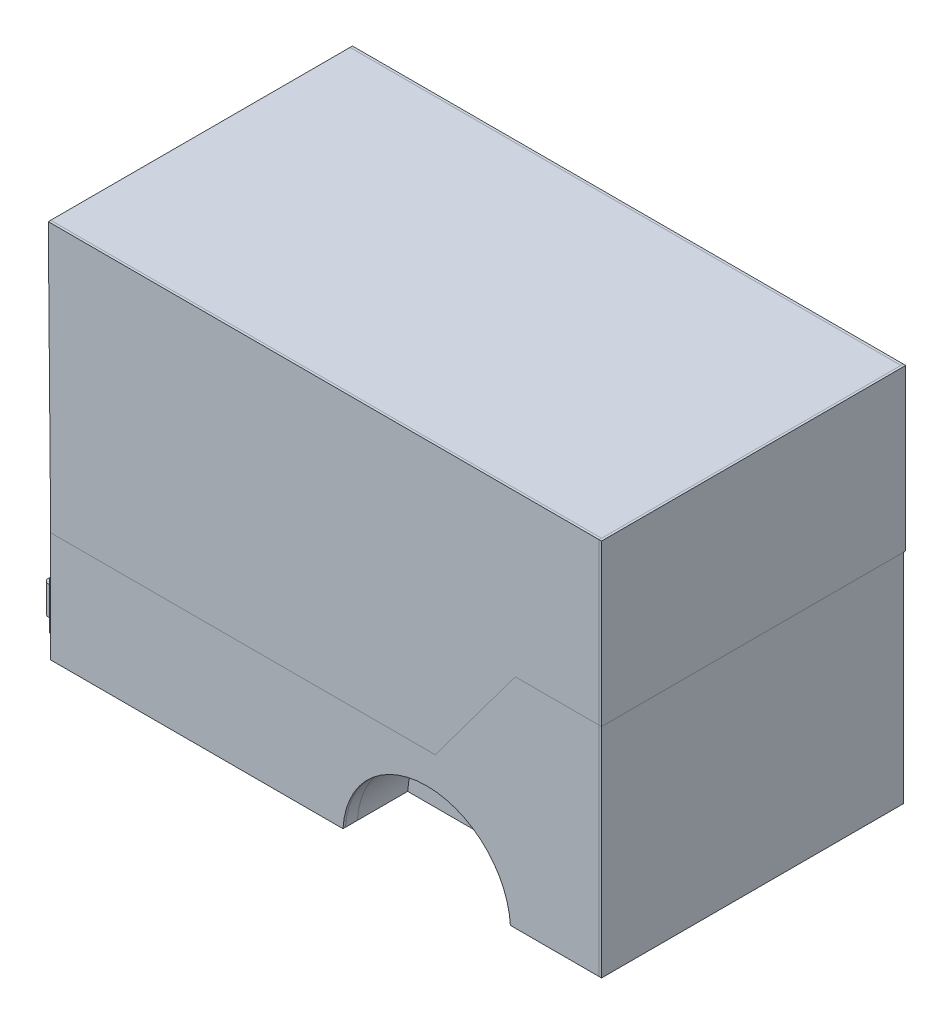
from build123d import *

# Parameters (mm, degrees)
SKETCH_1_W                = 229
SKETCH_1_H                = 125
EXTRUDE_1_DEPTH           = 88
SKETCH_4_W                = 125
SKETCH_4_H                = 88
SKETCH_4_W_2              = 123
SKETCH_4_H_2              = 86
CUT_EXTRUDE_3_DEPTH       = 1
SKETCH_5_W                = 125
SKETCH_5_H                = 88
EXTRUDE_2_DEPTH           = 1
SKETCH_11_W               = 5
SKETCH_11_H               = 20
EXTRUDE_3_DEPTH           = 2
SKETCH_12_R               = 2
EXTRUDE_4_DEPTH           = 12
SKETCH_13_R               = 35
CUT_EXTRUDE_7_DEPTH       = 26
CUT_EXTRUDE_START         = -26
SKETCH_14_R               = 35
CUT_EXTRUDE_8_DEPTH       = 26
SKETCH_16_W               = 229
SKETCH_16_H               = 125
EXTRUDE_6_DEPTH           = 70
SHELL_START               = -980.231317195
SHELL_1_OUTLINE_W         = 148
SHELL_1_OUTLINE_H         = 115
SHELL_1_DEPTH             = 113.617262665
SHELL_START_2             = -787.84857986
SHELL_1_2_OUTLINE_W       = 148
SHELL_1_2_OUTLINE_H       = 115
SHELL_1_2_DEPTH           = 31.617262665
SHELL_1_3_OUTLINE_W       = 3
SHELL_1_3_OUTLINE_H       = 63
SHELL_1_3_DEPTH           = 224
SHELL_START_3             = -981.231317195
SHELL_1_4_DEPTH           = 1
SHELL_START_4             = 7.020467364
SHELL_1_5_DEPTH           = 115
SHELL_START_5             = 33.020467364
SHELL_1_6_DEPTH           = 63
CUT_EXTRUDE_START_2       = -70
CUT_EXTRUDE_9_DEPTH       = 70
SKETCH_20_W               = 125
SKETCH_20_H               = 158
SKETCH_20_W_2             = 115
SKETCH_20_H_2             = 148
EXTRUDE_7_DEPTH           = 1
CUT_EXTRUDE_START_3       = -5
CUT_EXTRUDE_14_DEPTH      = 5
EXTRUDE_8_DEPTH           = 5
SKETCH_26_W               = 230
SKETCH_26_H               = 125
CUT_EXTRUDE_15_DEPTH      = 5
SKETCH_27_W               = 230
SKETCH_27_H               = 125
EXTRUDE_9_DEPTH           = 5
SKETCH_28_W               = 5
SKETCH_28_H               = 115
EXTRUDE_10_DEPTH          = 148
EXTRUDE_11_DEPTH          = 1
EXTRUDE_12_DEPTH          = 1
SKETCH_32_W               = 127
SKETCH_32_H               = 67.090624259
EXTRUDE_13_DEPTH          = 1
SKETCH_33_W               = 126
SKETCH_33_H               = 90.909375741
EXTRUDE_14_DEPTH          = 1
CUT_EXTRUDE_16_DEPTH      = 40
CUT_EXTRUDE_16_DEPTH_BACK = 10
SKETCH_34_W               = 225
SKETCH_34_H               = 5
SKETCH_35_W               = 220
SKETCH_35_H               = 153
EXTRUDE_16_DEPTH          = 5
SKETCH_36_W               = 5
SKETCH_36_H               = 153
EXTRUDE_17_DEPTH          = 5
CUT_EXTRUDE_17_DEPTH      = 5
SKETCH_39_W               = 115
SKETCH_39_H               = 5
CUT_EXTRUDE_18_DEPTH      = 5
SKETCH_40_W               = 5
SKETCH_40_H               = 120
EXTRUDE_19_DEPTH          = 153
SKETCH_45_W               = 78.76547467
SKETCH_45_H               = 26
EXTRUDE_21_DEPTH          = 33
CUT_EXTRUDE_20_DEPTH      = 21
SKETCH_48_R               = 34.912032086
CUT_EXTRUDE_21_DEPTH      = 21


with BuildPart() as part:
    # 스케치1 → 보스-돌출1 (new body)
    with BuildSketch(Plane(origin=(0, 0, 0), x_dir=(1, 0, 0), z_dir=(0, 1, 0))):
        with Locations((-871.731317195, -64.520467364)):
            Rectangle(SKETCH_1_W, SKETCH_1_H)
    extrude(amount=EXTRUDE_1_DEPTH)

    # 스케치4 → 컷-돌출3 (cut)
    # profile 1 of 2: a face of its own
    with BuildSketch(Plane.ZY.offset(986.231317195)):
        with Locations((64.520467364, 44)):
            Rectangle(SKETCH_4_W, SKETCH_4_H)
        with Locations((64.520467364, 44)):
            Rectangle(SKETCH_4_W_2, SKETCH_4_H_2, mode=Mode.SUBTRACT)
    # profile 2 of 2: a face of its own
    with BuildSketch(Plane.ZY.offset(986.231317195)):
        with BuildLine():
            Line((6.020467364, 84), (6.020467364, 67.306026885))
            ThreePointArc((6.020467364, 67.306026885), (6.552613646, 56.95178287), (8.143444971, 46.70664722))
            Line((8.143444971, 46.70664722), (8.939528918, 42.885444272))
            ThreePointArc((8.939528918, 42.885444272), (10.498858633, 32.843182595), (11.020467364, 22.693973115))
            Line((11.020467364, 22.693973115), (11.020467364, 2))
            Line((11.020467364, 2), (118.020467364, 2))
            Line((118.020467364, 2), (118.020467364, 22.693973115))
            ThreePointArc((118.020467364, 22.693973115), (118.542076095, 32.843182595), (120.10140581, 42.885444272))
            Line((120.10140581, 42.885444272), (120.897489758, 46.70664722))
            ThreePointArc((120.897489758, 46.70664722), (122.488321083, 56.95178287), (123.020467364, 67.306026885))
            Line((123.020467364, 67.306026885), (123.020467364, 84))
            Line((123.020467364, 84), (6.020467364, 84))
        make_face()
        with BuildLine():
            Line((12.020467364, 22.693973115), (12.020467364, 3))
            Line((12.020467364, 3), (117.020467364, 3))
            Line((117.020467364, 3), (117.020467364, 22.693973115))
            ThreePointArc((117.020467364, 22.693973115), (117.547344871, 32.945699863), (119.122425391, 43.089398526))
            Line((119.122425391, 43.089398526), (119.918509338, 46.910601474))
            ThreePointArc((119.918509338, 46.910601474), (121.493589858, 57.054300137), (122.020467364, 67.306026885))
            Line((122.020467364, 67.306026885), (122.020467364, 83))
            Line((122.020467364, 83), (7.020467364, 83))
            Line((7.020467364, 83), (7.020467364, 67.306026885))
            ThreePointArc((7.020467364, 67.306026885), (7.547344871, 57.054300137), (9.122425391, 46.910601474))
            Line((9.122425391, 46.910601474), (9.918509338, 43.089398526))
            ThreePointArc((9.918509338, 43.089398526), (11.493589858, 32.945699863), (12.020467364, 22.693973115))
        make_face(mode=Mode.SUBTRACT)
    extrude(amount=-CUT_EXTRUDE_3_DEPTH, mode=Mode.SUBTRACT)

    # 스케치5 → 보스-돌출2 (add)
    with BuildSketch(Plane(origin=(-757.231317195, 0, 0), x_dir=(0, 0, -1), z_dir=(1, 0, 0))):
        with Locations((-64.520467364, 44)):
            Rectangle(SKETCH_5_W, SKETCH_5_H)
    extrude(amount=EXTRUDE_2_DEPTH)

    # 스케치13 → 컷-돌출7 (cut)
    with BuildSketch(Plane.XY.offset(127.020467364)):
        with Locations((-827.231317195, -2)):
            Circle(SKETCH_13_R)
    extrude(amount=-CUT_EXTRUDE_7_DEPTH, mode=Mode.SUBTRACT)

    # 스케치14 → 컷-돌출8 (cut)
    with BuildSketch(Plane(origin=(0, 0, 2.020467364), x_dir=(-1, 0, 0), z_dir=(0, 0, -1)).offset(CUT_EXTRUDE_START)):
        with Locations((827.231317195, -2)):
            Circle(SKETCH_14_R)
    extrude(amount=CUT_EXTRUDE_8_DEPTH, mode=Mode.SUBTRACT)

    # 스케치16 → 보스-돌출6 (add)
    with BuildSketch(Plane(origin=(0, 88, 0), x_dir=(1, 0, 0), z_dir=(0, 1, 0))):
        with Locations((-870.731317195, -64.520467364)):
            Rectangle(SKETCH_16_W, SKETCH_16_H)
    extrude(amount=EXTRUDE_6_DEPTH)

    # 쉘1: read off the stored shape, not the designer's step
    # 쉘1 outline → 쉘1 (cut)
    with BuildSketch(Plane.YZ.offset(SHELL_START)):
        with Locations((79, 64.520467364)):
            Rectangle(SHELL_1_OUTLINE_W, SHELL_1_OUTLINE_H)
    extrude(amount=SHELL_1_DEPTH, mode=Mode.SUBTRACT)

    # Shell 1 2 outline → Shell 1 2 (cut)
    with BuildSketch(Plane.YZ.offset(SHELL_START_2)):
        with Locations((79, 64.520467364)):
            Rectangle(SHELL_1_2_OUTLINE_W, SHELL_1_2_OUTLINE_H)
    extrude(amount=SHELL_1_2_DEPTH, mode=Mode.SUBTRACT)

    # Shell 1 3 outline → Shell 1 3 (cut)
    with BuildSketch(Plane.YZ.offset(SHELL_START)):
        with Locations((6.5, 64.520467364)):
            Rectangle(SHELL_1_3_OUTLINE_W, SHELL_1_3_OUTLINE_H)
    extrude(amount=SHELL_1_3_DEPTH, mode=Mode.SUBTRACT)

    # Shell 1 4 outline → Shell 1 4 (cut)
    with BuildSketch(Plane.YZ.offset(SHELL_START_3)):
        with BuildLine():
            Line((8, 96.020467364), (8, 33.020467364))
            Line((8, 33.020467364), (8, 17.020467364))
            Line((8, 17.020467364), (22.693973115, 17.020467364))
            ThreePointArc((22.693973115, 17.020467364), (33.4582862, 16.467245983), (44.109169797, 14.813411437))
            Line((44.109169797, 14.813411437), (47.930372745, 14.017327489))
            ThreePointArc((47.930372745, 14.017327489), (57.566886475, 12.521000995), (67.306026885, 12.020467364))
            Line((67.306026885, 12.020467364), (78, 12.020467364))
            Line((78, 12.020467364), (78, 117.020467364))
            Line((78, 117.020467364), (67.306026885, 117.020467364))
            ThreePointArc((67.306026885, 117.020467364), (57.566886475, 116.519933734), (47.930372745, 115.023607239))
            Line((47.930372745, 115.023607239), (44.109169797, 114.227523292))
            ThreePointArc((44.109169797, 114.227523292), (33.4582862, 112.573688746), (22.693973115, 112.020467364))
            Line((22.693973115, 112.020467364), (8, 112.020467364))
            Line((8, 112.020467364), (8, 96.020467364))
        make_face()
    extrude(amount=SHELL_1_4_DEPTH, mode=Mode.SUBTRACT)

    # Shell 1 5 outline → Shell 1 5 (cut)
    with BuildSketch(Plane.XY.offset(SHELL_START_4)):
        with BuildLine():
            Line((-787.84857986, 5), (-787.84857986, 153))
            Line((-787.84857986, 153), (-866.61405453, 153))
            Line((-866.61405453, 153), (-866.61405453, 5))
            ThreePointArc((-866.61405453, 5), (-827.231317195, 38), (-787.84857986, 5))
        make_face()
    extrude(amount=SHELL_1_5_DEPTH, mode=Mode.SUBTRACT)

    # Shell 1 6 outline → Shell 1 6 (cut)
    with BuildSketch(Plane.XY.offset(SHELL_START_5)):
        with BuildLine():
            Line((-865.961150657, 8), (-788.501483733, 8))
            ThreePointArc((-788.501483733, 8), (-827.231317195, 38), (-865.961150657, 8))
        make_face()
    extrude(amount=SHELL_1_6_DEPTH, mode=Mode.SUBTRACT)

    # 스케치18 → 컷-돌출9 (cut)
    with BuildSketch(Plane(origin=(-981.231317195, 0, 0), x_dir=(0, 0, -1), z_dir=(1, 0, 0)).offset(CUT_EXTRUDE_START_2)):
        with BuildLine():
            Line((-17.020467364, 8), (-17.020467364, 22.693973115))
            ThreePointArc((-17.020467364, 22.693973115), (-16.467245983, 33.4582862), (-14.813411437, 44.109169797))
            Line((-14.813411437, 44.109169797), (-14.017327489, 47.930372745))
            ThreePointArc((-14.017327489, 47.930372745), (-12.521000995, 57.566886475), (-12.020467364, 67.306026885))
            Line((-12.020467364, 67.306026885), (-12.020467364, 78))
            Line((-12.020467364, 78), (-117.020467364, 78))
            Line((-117.020467364, 78), (-117.020467364, 67.306026885))
            ThreePointArc((-117.020467364, 67.306026885), (-116.519933734, 57.566886475), (-115.023607239, 47.930372745))
            Line((-115.023607239, 47.930372745), (-114.227523292, 44.109169797))
            ThreePointArc((-114.227523292, 44.109169797), (-112.573688746, 33.4582862), (-112.020467364, 22.693973115))
            Line((-112.020467364, 22.693973115), (-112.020467364, 8))
            Line((-112.020467364, 8), (-17.020467364, 8))
        make_face()
    extrude(amount=CUT_EXTRUDE_9_DEPTH, mode=Mode.SUBTRACT)

    # 스케치20 → 보스-돌출7 (add)
    with BuildSketch(Plane(origin=(-756.231317195, 0, 0), x_dir=(0, 0, -1), z_dir=(1, 0, 0))):
        with Locations((-64.520467364, 79)):
            Rectangle(SKETCH_20_W, SKETCH_20_H)
        with Locations((-64.520467364, 79)):
            Rectangle(SKETCH_20_W_2, SKETCH_20_H_2, mode=Mode.SUBTRACT)
    extrude(amount=EXTRUDE_7_DEPTH)

    # 스케치24 → 컷-돌출14 (cut)
    with BuildSketch(Plane.XY.offset(127.020467364).offset(CUT_EXTRUDE_START_3)):
        with BuildLine():
            Line((-755.231317195, 153), (-980.231317195, 153))
            Line((-980.231317195, 153), (-980.231317195, 5))
            Line((-980.231317195, 5), (-866.61405453, 5))
            ThreePointArc((-866.61405453, 5), (-827.231317195, 38), (-787.84857986, 5))
            Line((-787.84857986, 5), (-755.231317195, 5))
            Line((-755.231317195, 5), (-755.231317195, 153))
        make_face()
    extrude(amount=CUT_EXTRUDE_14_DEPTH, mode=Mode.SUBTRACT)

    # 스케치26 → 컷-돌출15 (cut)
    with BuildSketch(Plane(origin=(0, 158, 0), x_dir=(1, 0, 0), z_dir=(0, 1, 0))):
        with Locations((-870.231317195, -64.520467364)):
            Rectangle(SKETCH_26_W, SKETCH_26_H)
    extrude(amount=-CUT_EXTRUDE_15_DEPTH, mode=Mode.SUBTRACT)

    # 스케치34 → 컷-돌출16 (cut, two sides: drawn at the far end of the back side and taken through both)
    with BuildSketch(Plane(origin=(0, 5, 0), x_dir=(1, 0, 0), z_dir=(0, 1, 0)).offset(-CUT_EXTRUDE_16_DEPTH_BACK)):
        with Locations((-867.731317195, -124.520467364)):
            Rectangle(SKETCH_34_W, SKETCH_34_H)
    extrude(amount=CUT_EXTRUDE_16_DEPTH + CUT_EXTRUDE_16_DEPTH_BACK, mode=Mode.SUBTRACT)

    # 스케치39 → 컷-돌출18 (cut)
    with BuildSketch(Plane(origin=(-755.231317195, 0, 0), x_dir=(0, 0, -1), z_dir=(1, 0, 0))):
        with Locations((-64.520467364, 2.5)):
            Rectangle(SKETCH_39_W, SKETCH_39_H)
    extrude(amount=-CUT_EXTRUDE_18_DEPTH, mode=Mode.SUBTRACT)

    # 스케치45 → 보스-돌출21 (add)
    with BuildSketch(Plane(origin=(0, 5, 0), x_dir=(1, 0, 0), z_dir=(0, 1, 0))):
        with Locations((-827.231317195, -20.020467364)):
            Rectangle(SKETCH_45_W, SKETCH_45_H)
        with Locations((-827.231317195, -109.020467364)):
            Rectangle(SKETCH_45_W, SKETCH_45_H)
    extrude(amount=EXTRUDE_21_DEPTH)

    # 스케치47 → 컷-돌출20 (cut)
    with BuildSketch(Plane.XY.offset(122.020467364)):
        with BuildLine():
            Line((-862.174127614, 0), (-792.288506775, 0))
            ThreePointArc((-792.288506775, 0), (-827.231317195, 33), (-862.174127614, 0))
        make_face()
    extrude(amount=-CUT_EXTRUDE_20_DEPTH, mode=Mode.SUBTRACT)

    # 스케치48 → 컷-돌출21 (cut)
    with BuildSketch(Plane(origin=(0, 0, 7.020467364), x_dir=(-1, 0, 0), z_dir=(0, 0, -1))):
        with Locations((827.252311569, -1.914574066)):
            Circle(SKETCH_48_R)
    extrude(amount=-CUT_EXTRUDE_21_DEPTH, mode=Mode.SUBTRACT)


with BuildPart() as body_2:
    # 스케치11 → 보스-돌출3 (new body)
    with BuildSketch(Plane.ZY.offset(986.231317195)):
        with Locations((122.020467364, 16)):
            Rectangle(SKETCH_11_W, SKETCH_11_H)
    extrude(amount=EXTRUDE_3_DEPTH)

    # 스케치12 → 보스-돌출4 (add)
    with BuildSketch(Plane(origin=(0, 23, 0), x_dir=(1, 0, 0), z_dir=(0, 1, 0))):
        with Locations((-989.231317195, -122.020467364)):
            Circle(SKETCH_12_R)
    extrude(amount=-EXTRUDE_4_DEPTH)


with BuildPart() as body_3:
    # 대칭 복사1: mirrored copy
    add(body_2.part.mirror(Plane.XY.offset(64.520467364)))


with BuildPart() as body_4:
    # 스케치25 → 보스-돌출8 (new body)
    with BuildSketch(Plane.XY.offset(127.020467364)):
        with BuildLine():
            Line((-980.231317195, 153), (-755.231317195, 153))
            Line((-755.231317195, 153), (-755.231317195, 5))
            Line((-755.231317195, 5), (-787.616277727, 5))
            ThreePointArc((-787.616277727, 5), (-826.999015062, 38), (-866.381752397, 5))
            Line((-866.381752397, 5), (-980.231317195, 5))
            Line((-980.231317195, 5), (-980.231317195, 153))
        make_face()
    extrude(amount=-EXTRUDE_8_DEPTH)


with BuildPart() as body_5:
    # 스케치27 → 보스-돌출9 (new body)
    with BuildSketch(Plane(origin=(0, 153, 0), x_dir=(1, 0, 0), z_dir=(0, 1, 0))):
        with Locations((-870.231317195, -64.520467364)):
            Rectangle(SKETCH_27_W, SKETCH_27_H)
    extrude(amount=EXTRUDE_9_DEPTH)


with BuildPart() as body_6:
    # 스케치28 → 보스-돌출10 (new body)
    with BuildSketch(Plane(origin=(0, 5, 0), x_dir=(1, 0, 0), z_dir=(0, 1, 0))):
        with Locations((-757.731317195, -64.520467364)):
            Rectangle(SKETCH_28_W, SKETCH_28_H)
    extrude(amount=EXTRUDE_10_DEPTH)


with BuildPart() as body_7:
    # 스케치29 → 보스-돌출11 (new body)
    with BuildSketch(Plane(origin=(0, 0, 2.020467364), x_dir=(-1, 0, 0), z_dir=(0, 0, -1))):
        with BuildLine():
            Line((984.231317195, 0), (984.231317195, 46))
            Line((984.231317195, 46), (823.655113572, 46))
            Line((823.655113572, 46), (790.231317195, 90.909375741))
            Line((790.231317195, 90.909375741), (755.231317195, 90.909375741))
            Line((755.231317195, 90.909375741), (755.231317195, 0))
            Line((755.231317195, 0), (792.288506775, 0))
            ThreePointArc((792.288506775, 0), (827.231317195, 33), (862.174127614, 0))
            Line((862.174127614, 0), (984.231317195, 0))
        make_face()
    extrude(amount=EXTRUDE_11_DEPTH)


with BuildPart() as body_8:
    # 스케치30 → 보스-돌출12 (new body)
    with BuildSketch(Plane(origin=(0, 0, 2.020467364), x_dir=(-1, 0, 0), z_dir=(0, 0, -1))):
        Polygon((755.231317195, 90.909375741), (755.231317195, 158), (985.231317195, 158), (984.231317195, 46), (823.655113572, 46), (790.231317195, 90.909375741), align=None)
    extrude(amount=EXTRUDE_12_DEPTH)


with BuildPart() as body_8_2:
    # 대칭 복사3: mirrored copy
    add(body_8.part.mirror(Plane.XY.offset(64.520467364)))


with BuildPart() as body_9:
    # Mirror 3 2: mirrored copy
    add(body_7.part.mirror(Plane.XY.offset(64.520467364)))


with BuildPart() as body_10:
    # 스케치32 → 보스-돌출13 (new body)
    with BuildSketch(Plane(origin=(-755.231317195, 0, 0), x_dir=(0, 0, -1), z_dir=(1, 0, 0))):
        with Locations((-64.520467364, 124.454687871)):
            Rectangle(SKETCH_32_W, SKETCH_32_H)
    extrude(amount=EXTRUDE_13_DEPTH)


with BuildPart() as body_11:
    # 스케치33 → 보스-돌출14 (new body)
    with BuildSketch(Plane(origin=(-755.231317195, 0, 0), x_dir=(0, 0, -1), z_dir=(1, 0, 0))):
        with Locations((-65.020467364, 45.454687871)):
            Rectangle(SKETCH_33_W, SKETCH_33_H)
    extrude(amount=EXTRUDE_14_DEPTH)


with BuildPart() as body_12:
    # 대칭 복사4: mirrored copy
    add(body_2.part.mirror(Plane.XY.offset(64.520467364)))


with BuildPart() as body_12_2:
    # 스케치35 → 보스-돌출16 (new body)
    with BuildSketch(Plane.XY.offset(122.020467364)):
        with Locations((-870.231317195, 76.5)):
            Rectangle(SKETCH_35_W, SKETCH_35_H)
    extrude(amount=EXTRUDE_16_DEPTH)

    # 스케치36 → 보스-돌출17 (add)
    with BuildSketch(Plane(origin=(-760.231317195, 0, 0), x_dir=(0, 0, -1), z_dir=(1, 0, 0))):
        with Locations((-124.520467364, 76.5)):
            Rectangle(SKETCH_36_W, SKETCH_36_H)
    extrude(amount=EXTRUDE_17_DEPTH)

    # 스케치37 → 컷-돌출17 (cut)
    with BuildSketch(Plane.XY.offset(127.020467364)):
        with BuildLine():
            Line((-862.174127614, 0), (-792.288506775, 0))
            ThreePointArc((-792.288506775, 0), (-827.231317195, 33), (-862.174127614, 0))
        make_face()
    extrude(amount=-CUT_EXTRUDE_17_DEPTH, mode=Mode.SUBTRACT)


with BuildPart() as body_12_3:
    # 스케치40 → 보스-돌출19 (new body)
    with BuildSketch(Plane.XZ):
        with Locations((-757.731317195, 67.020467364)):
            Rectangle(SKETCH_40_W, SKETCH_40_H)
    extrude(amount=-EXTRUDE_19_DEPTH)


solid = Compound([part.part, body_2.part, body_5.part, body_7.part, body_8.part, body_8_2.part, body_9.part, body_10.part, body_11.part, body_12.part, body_12_2.part, body_12_3.part])
